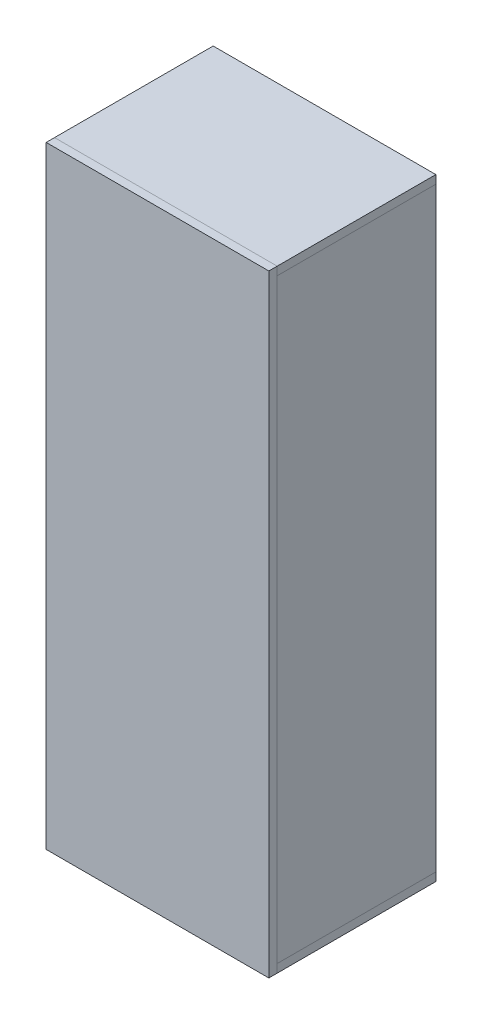
from build123d import *

# Parameters (mm, degrees)
SKETCH1_W           = 400
SKETCH1_H           = 300
BOSS_EXTRUDE1_DEPTH = 1100
SHELL1_T            = -15
SPLIT2_START        = -7812.732568069
SPLIT2_OUTLINE_W    = 400
SPLIT2_OUTLINE_H    = 285
SPLIT2_DEPTH        = 15
SPLIT2_START_2      = -8897.732568069
SPLIT2_2_OUTLINE_W  = 15
SPLIT2_2_OUTLINE_H  = 285
SPLIT2_2_DEPTH      = 1100
SPLIT2_3_OUTLINE_W  = 385
SPLIT2_3_OUTLINE_H  = 285
SPLIT2_3_DEPTH      = 15
SPLIT2_4_OUTLINE_W  = 385
SPLIT2_4_OUTLINE_H  = 285
SPLIT2_4_DEPTH      = 15
SPLIT2_START_3      = -8882.732568069
SPLIT2_5_OUTLINE_W  = 15
SPLIT2_5_OUTLINE_H  = 285
SPLIT2_5_DEPTH      = 1070
SPLIT2_6_OUTLINE_W  = 400
SPLIT2_6_OUTLINE_H  = 285
SPLIT2_6_DEPTH      = 15


# Read off the part's stored shape, not the designer's step: Split2
with BuildPart() as part:
    # Sketch1 → Boss-Extrude1 (new body)
    with BuildSketch(Plane(origin=(0, -8897.732568069, 0), x_dir=(1, 0, 0), z_dir=(0, 1, 0))):
        with Locations((-588.349422114, 459.224669701)):
            Rectangle(SKETCH1_W, SKETCH1_H)
    extrude(amount=BOSS_EXTRUDE1_DEPTH)

    # Shell1
    shell1_openings = [part.faces().sort_by_distance(p)[0] for p in [
        (-588.349422114, -8347.732568069, -609.224669701),
    ]]
    offset(amount=SHELL1_T, openings=shell1_openings, kind=Kind.INTERSECTION)


with BuildPart() as body_2:
    # Split1: the piece on the far side of the plane
    add(part.part)
    split(bisect_by=Plane(origin=(0, 0, -324.224669701), x_dir=(-1, 0, 0), z_dir=(0, 0, -1)), keep=Keep.BOTTOM)


with BuildPart() as part_1:
    add(part.part)

    # Split1
    split(bisect_by=Plane(origin=(0, 0, -324.224669701), x_dir=(-1, 0, 0), z_dir=(0, 0, -1)), keep=Keep.TOP)

    # Split2 2 outline → Split2 2 (cut)
    with BuildSketch(Plane(origin=(0, 0, 0), x_dir=(1, 0, 0), z_dir=(0, 1, 0)).offset(SPLIT2_START_2)):
        with Locations((-780.849422114, 466.724669701)):
            Rectangle(SPLIT2_2_OUTLINE_W, SPLIT2_2_OUTLINE_H)
    extrude(amount=SPLIT2_2_DEPTH, mode=Mode.SUBTRACT)

    # Split2 3 outline → Split2 3 (cut)
    with BuildSketch(Plane(origin=(0, 0, 0), x_dir=(1, 0, 0), z_dir=(0, 1, 0)).offset(SPLIT2_START_2)):
        with Locations((-580.849422114, 466.724669701)):
            Rectangle(SPLIT2_3_OUTLINE_W, SPLIT2_3_OUTLINE_H)
    extrude(amount=SPLIT2_3_DEPTH, mode=Mode.SUBTRACT)

    # Split2 4 outline → Split2 4 (cut)
    with BuildSketch(Plane(origin=(0, 0, 0), x_dir=(1, 0, 0), z_dir=(0, 1, 0)).offset(SPLIT2_START)):
        with Locations((-580.849422114, 466.724669701)):
            Rectangle(SPLIT2_4_OUTLINE_W, SPLIT2_4_OUTLINE_H)
    extrude(amount=SPLIT2_4_DEPTH, mode=Mode.SUBTRACT)


with BuildPart() as body_3:
    # Split2 outline → Split2 (new body)
    with BuildSketch(Plane(origin=(0, 0, 0), x_dir=(1, 0, 0), z_dir=(0, 1, 0)).offset(SPLIT2_START)):
        with Locations((-588.349422114, 466.724669701)):
            Rectangle(SPLIT2_OUTLINE_W, SPLIT2_OUTLINE_H)
    extrude(amount=SPLIT2_DEPTH)


with BuildPart() as body_4:
    # Split2 5 outline → Split2 5 (new body)
    with BuildSketch(Plane(origin=(0, 0, 0), x_dir=(1, 0, 0), z_dir=(0, 1, 0)).offset(SPLIT2_START_3)):
        with Locations((-780.849422114, 466.724669701)):
            Rectangle(SPLIT2_5_OUTLINE_W, SPLIT2_5_OUTLINE_H)
    extrude(amount=SPLIT2_5_DEPTH)


with BuildPart() as body_5:
    # Split2 6 outline → Split2 6 (new body)
    with BuildSketch(Plane(origin=(0, 0, 0), x_dir=(1, 0, 0), z_dir=(0, 1, 0)).offset(SPLIT2_START_2)):
        with Locations((-588.349422114, 466.724669701)):
            Rectangle(SPLIT2_6_OUTLINE_W, SPLIT2_6_OUTLINE_H)
    extrude(amount=SPLIT2_6_DEPTH)


solid = Compound([body_2.part, part_1.part, body_3.part, body_4.part, body_5.part])
